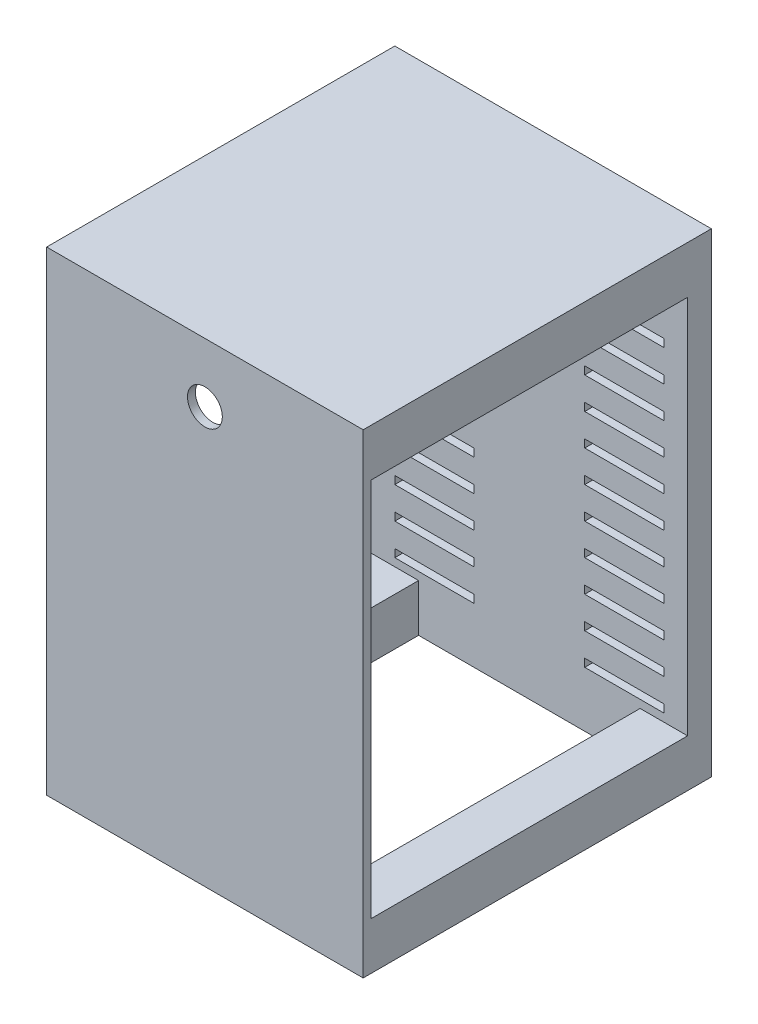
from build123d import *

# Parameters (mm, degrees)
CROQUIS1_W              = 200
CROQUIS1_H              = 300
SALIENTE_EXTRUIR2_DEPTH = 15
CROQUIS2_W              = 30
CROQUIS2_H              = 30
SALIENTE_EXTRUIR3_DEPTH = 200
CROQUIS3_W              = 200
CROQUIS3_H              = 300
SALIENTE_EXTRUIR4_DEPTH = 5
CROQUIS7_W              = 50
CROQUIS7_H              = 5
CORTAR_EXTRUIR1_DEPTH   = 20
CROQUIS9_W              = 200
CROQUIS9_H              = 220
SALIENTE_EXTRUIR6_DEPTH = 5
CROQUIS11_R             = 11
CORTAR_EXTRUIR3_DEPTH   = 10


with BuildPart() as part:
    # Croquis1 → Saliente-Extruir2 (new body)
    with BuildSketch(Plane.XY):
        Rectangle(CROQUIS1_W, CROQUIS1_H)
    extrude(amount=SALIENTE_EXTRUIR2_DEPTH)

    # Croquis2 → Saliente-Extruir3 (add)
    with BuildSketch(Plane.XY.offset(15)):
        with Locations((-85, 135)):
            Rectangle(CROQUIS2_W, CROQUIS2_H)
        with Locations((85, 135)):
            Rectangle(CROQUIS2_W, CROQUIS2_H)
        with Locations((-85, -135)):
            Rectangle(CROQUIS2_W, CROQUIS2_H)
        with Locations((85, -135)):
            Rectangle(CROQUIS2_W, CROQUIS2_H)
    extrude(amount=SALIENTE_EXTRUIR3_DEPTH)

    # Croquis3 → Saliente-Extruir4 (add)
    with BuildSketch(Plane.XY.offset(215)):
        Rectangle(CROQUIS3_W, CROQUIS3_H)
    extrude(amount=SALIENTE_EXTRUIR4_DEPTH)

    # Croquis7 → Cortar-Extruir1 (cut)
    with BuildSketch(Plane(origin=(0, 0, 0), x_dir=(-1, 0, 0), z_dir=(0, 0, -1))):
        with Locations((60, 107.5)):
            Rectangle(CROQUIS7_W, CROQUIS7_H)
        with Locations((-60, 107.5)):
            Rectangle(CROQUIS7_W, CROQUIS7_H)
        with Locations((60, 87.5)):
            Rectangle(CROQUIS7_W, CROQUIS7_H)
        with Locations((60, 67.5)):
            Rectangle(CROQUIS7_W, CROQUIS7_H)
        with Locations((60, 47.5)):
            Rectangle(CROQUIS7_W, CROQUIS7_H)
        with Locations((60, 27.5)):
            Rectangle(CROQUIS7_W, CROQUIS7_H)
        with Locations((60, 7.5)):
            Rectangle(CROQUIS7_W, CROQUIS7_H)
        with Locations((60, -12.5)):
            Rectangle(CROQUIS7_W, CROQUIS7_H)
        with Locations((60, -32.5)):
            Rectangle(CROQUIS7_W, CROQUIS7_H)
        with Locations((60, -52.5)):
            Rectangle(CROQUIS7_W, CROQUIS7_H)
        with Locations((60, -72.5)):
            Rectangle(CROQUIS7_W, CROQUIS7_H)
        with Locations((-60, 87.5)):
            Rectangle(CROQUIS7_W, CROQUIS7_H)
        with Locations((-60, 67.5)):
            Rectangle(CROQUIS7_W, CROQUIS7_H)
        with Locations((-60, 47.5)):
            Rectangle(CROQUIS7_W, CROQUIS7_H)
        with Locations((-60, 27.5)):
            Rectangle(CROQUIS7_W, CROQUIS7_H)
        with Locations((-60, 7.5)):
            Rectangle(CROQUIS7_W, CROQUIS7_H)
        with Locations((-60, -12.5)):
            Rectangle(CROQUIS7_W, CROQUIS7_H)
        with Locations((-60, -32.5)):
            Rectangle(CROQUIS7_W, CROQUIS7_H)
        with Locations((-60, -52.5)):
            Rectangle(CROQUIS7_W, CROQUIS7_H)
        with Locations((-60, -72.5)):
            Rectangle(CROQUIS7_W, CROQUIS7_H)
        with Locations((-60, -92.5)):
            Rectangle(CROQUIS7_W, CROQUIS7_H)
        with Locations((60, -92.5)):
            Rectangle(CROQUIS7_W, CROQUIS7_H)
        with Locations((-60, -112.5)):
            Rectangle(CROQUIS7_W, CROQUIS7_H)
        with Locations((60, -112.5)):
            Rectangle(CROQUIS7_W, CROQUIS7_H)
    extrude(amount=-CORTAR_EXTRUIR1_DEPTH, mode=Mode.SUBTRACT)

    # Croquis9 → Saliente-Extruir6 (add)
    with BuildSketch(Plane(origin=(0, 150, 0), x_dir=(1, 0, 0), z_dir=(0, 1, 0))):
        with Locations((0, -110)):
            Rectangle(CROQUIS9_W, CROQUIS9_H)
    extrude(amount=-SALIENTE_EXTRUIR6_DEPTH)

    # Croquis11 → Cortar-Extruir3 (cut)
    with BuildSketch(Plane.XY.offset(220)):
        with Locations((0, 112.552753257)):
            Circle(CROQUIS11_R)
    extrude(amount=-CORTAR_EXTRUIR3_DEPTH, mode=Mode.SUBTRACT)


solid = part.part
